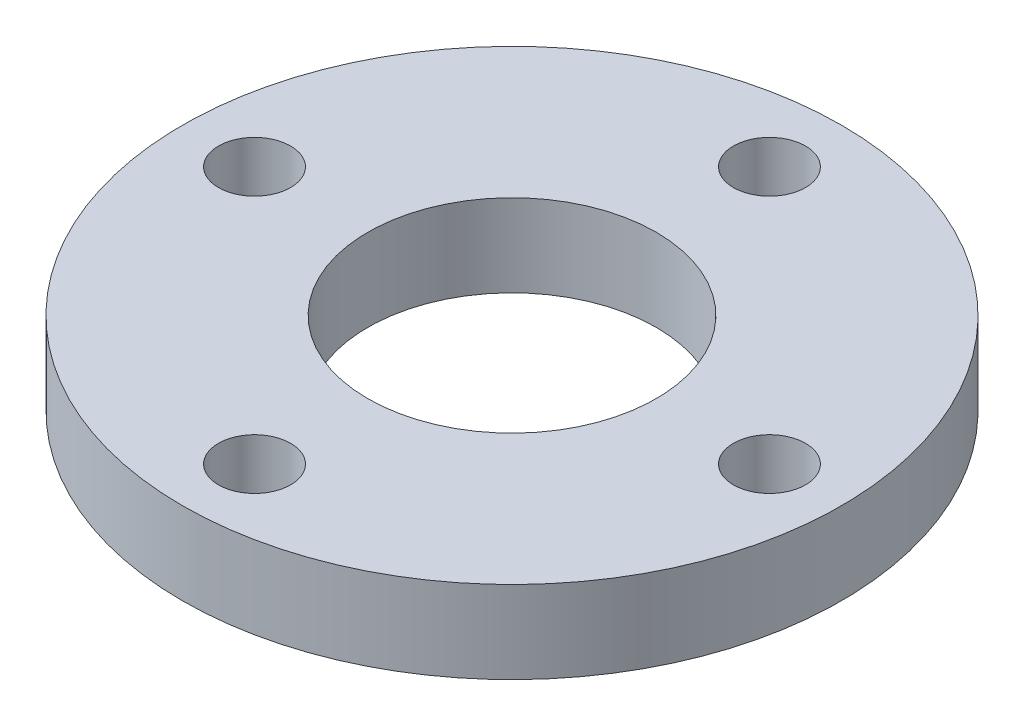
from build123d import *

# Parameters (mm, degrees)
SKETCH1_R           = 16
SKETCH1_R_2         = 7
SKETCH1_R_3         = 1.75
BOSS_EXTRUDE1_DEPTH = 4


with BuildPart() as part:
    # Sketch1 → Boss-Extrude1 (new body)
    with BuildSketch(Plane(origin=(0, 0, 0), x_dir=(1, 0, 0), z_dir=(0, 1, 0))):
        Circle(SKETCH1_R)
        Circle(SKETCH1_R_2, mode=Mode.SUBTRACT)
        with Locations((0, 12.5)):
            Circle(SKETCH1_R_3, mode=Mode.SUBTRACT)
        with Locations((12.5, 0)):
            Circle(SKETCH1_R_3, mode=Mode.SUBTRACT)
        with Locations((0, -12.5)):
            Circle(SKETCH1_R_3, mode=Mode.SUBTRACT)
        with Locations((-12.5, 0)):
            Circle(SKETCH1_R_3, mode=Mode.SUBTRACT)
    extrude(amount=BOSS_EXTRUDE1_DEPTH)


solid = part.part
